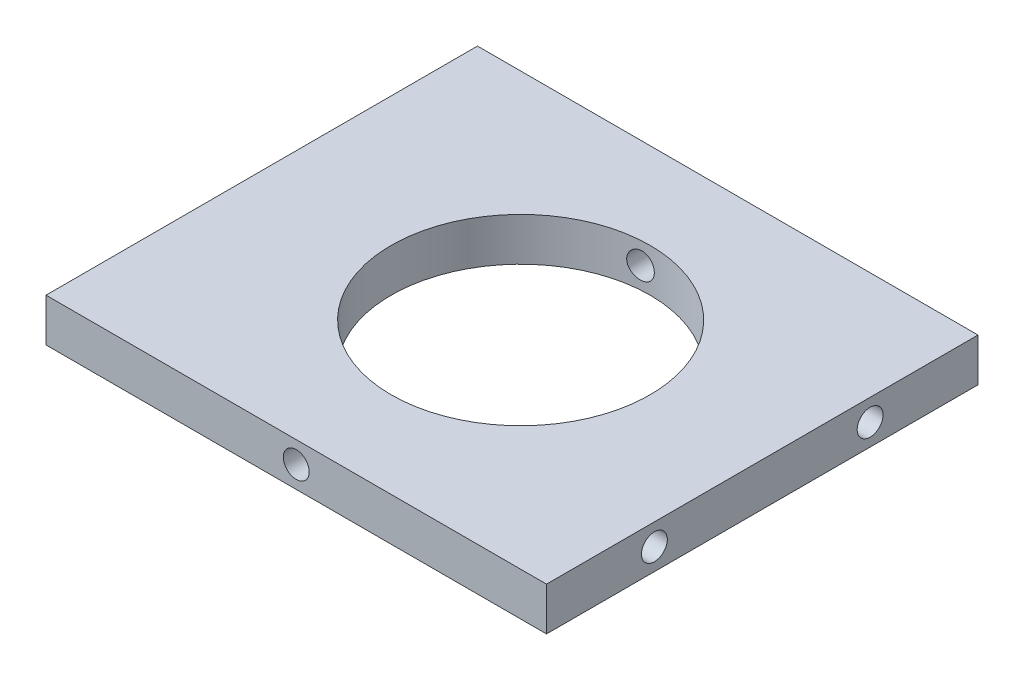
from build123d import *

# Parameters (mm, degrees)
ESQUISSE1_W             = 58
ESQUISSE1_H             = 5
BOSS_EXTRU_1_DEPTH      = 50
ESQUISSE2_R             = 15
ENL_V_MAT_EXTRU_1_DEPTH = 73.672209269
ESQUISSE3_R             = 1.5
ENL_V_MAT_EXTRU_2_DEPTH = 10
ENL_V_START             = -10
ESQUISSE4_R             = 1.5
ENL_V_MAT_EXTRU_3_DEPTH = 10
ESQUISSE5_R             = 1.5
ENL_V_MAT_EXTRU_4_DEPTH = 89.069574769


with BuildPart() as part:
    # Esquisse1 → Boss.-Extru.1 (new body)
    with BuildSketch(Plane.XY):
        with Locations((23.5, -47.5)):
            Rectangle(ESQUISSE1_W, ESQUISSE1_H)
    extrude(amount=BOSS_EXTRU_1_DEPTH)

    # Esquisse2 → Enlèv. mat.-Extru.1 (cut, through all)
    with BuildSketch(Plane(origin=(0, -45, 0), x_dir=(-1, 0, 0), z_dir=(0, 1, 0))):
        with Locations((-24.5, 25)):
            Circle(ESQUISSE2_R)
    extrude(amount=-ENL_V_MAT_EXTRU_1_DEPTH, mode=Mode.SUBTRACT)

    # Esquisse3 → Enlèv. mat.-Extru.2 (cut)
    with BuildSketch(Plane.ZY.offset(5.5)):
        with Locations((12.5, -47.5)):
            Circle(ESQUISSE3_R)
        with Locations((37.5, -47.5)):
            Circle(ESQUISSE3_R)
    extrude(amount=-ENL_V_MAT_EXTRU_2_DEPTH, mode=Mode.SUBTRACT)

    # Esquisse4 → Enlèv. mat.-Extru.3 (cut)
    with BuildSketch(Plane(origin=(52.5, 0, 0), x_dir=(0, 0, -1), z_dir=(1, 0, 0)).offset(ENL_V_START)):
        with Locations((-37.5, -47.5)):
            Circle(ESQUISSE4_R)
        with Locations((-12.5, -47.5)):
            Circle(ESQUISSE4_R)
    extrude(amount=ENL_V_MAT_EXTRU_3_DEPTH, mode=Mode.SUBTRACT)

    # Esquisse5 → Enlèv. mat.-Extru.4 (cut, through all)
    with BuildSketch(Plane.XY.offset(50)):
        with Locations((23.5, -47.5)):
            Circle(ESQUISSE5_R)
    extrude(amount=-ENL_V_MAT_EXTRU_4_DEPTH, mode=Mode.SUBTRACT)


solid = part.part
